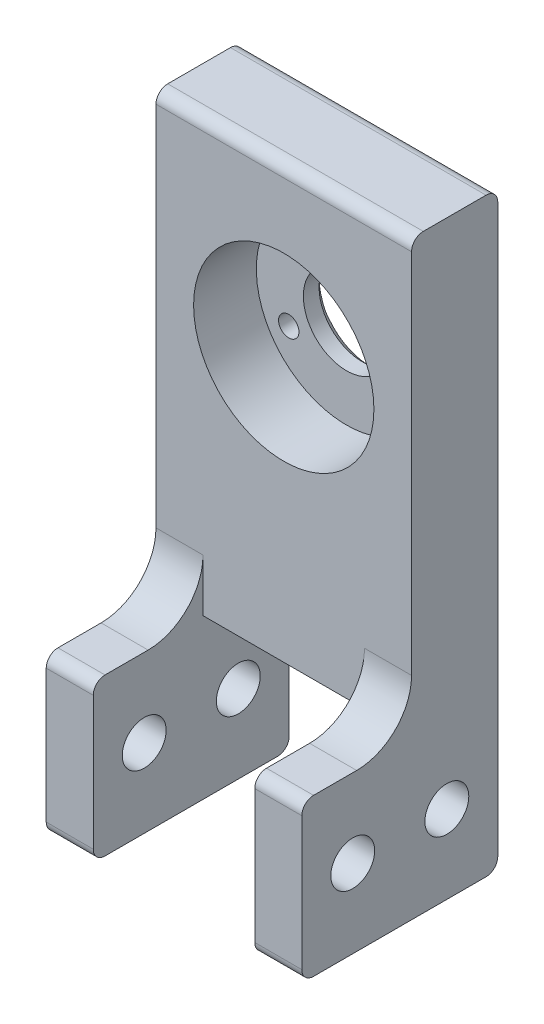
from build123d import *

# Parameters (mm, degrees)
EXTRUDE1_DEPTH      = 10.3
EXTRUDE1_DEPTH_BACK = 10.3
SKETCH1_W           = 11
SKETCH1_H           = 55
EXTRUDE2_DEPTH      = 6
SKETCH5_R           = 5.5
EXTRUDE4_DEPTH      = 69.744308855
SKETCH_1_R          = 2.8
CUT_EXTRUDE_1_DEPTH = 76.545350618
FILLET2_R           = 1.5
SKETCH_3_R          = 11.5
CUT_EXTRUDE_2_DEPTH = 8
SKETCH_4_R          = 1.3
CUT_EXTRUDE_3_DEPTH = 71.80805039
CHAMFER_1_SIZE      = 1


with BuildPart() as part:
    # Sketch1 → Extrude1 (new, two sides: drawn at the far end of the back side and taken through both)
    with BuildSketch(Plane(origin=(0, 0, 0), x_dir=(0, 0, -1), z_dir=(1, 0, 0)).offset(-EXTRUDE1_DEPTH_BACK)):
        with Locations((0, 37.8)):
            Rectangle(SKETCH1_W, SKETCH1_H)
    extrude(amount=EXTRUDE1_DEPTH + EXTRUDE1_DEPTH_BACK)

    # Sketch2 → Extrude2 (add)
    with BuildSketch(Plane(origin=(10.3, 0, 0), x_dir=(0, 0, -1), z_dir=(1, 0, 0))):
        with BuildLine():
            Line((-19.5, 10), (-19.5, -10))
            Line((-19.5, -10), (5.5, -10))
            Line((5.5, -10), (5.5, 17))
            Line((5.5, 17), (5.5, 65.3))
            Line((5.5, 65.3), (-5.5, 65.3))
            Line((-5.5, 65.3), (-5.5, 17))
            ThreePointArc((-5.5, 17), (-7.550252532, 12.050252532), (-12.5, 10))
            Line((-12.5, 10), (-19.5, 10))
        make_face()
    extrude2 = extrude(amount=EXTRUDE2_DEPTH)

    # Mirror2: Extrude2 across plane
    add(extrude2.mirror(Plane(origin=(0, 0, 0), x_dir=(0, 0, 1), z_dir=(1, 0, 0))))

    # Sketch5 → Extrude4 (cut, through all)
    with BuildSketch(Plane.XY.offset(5.5)):
        with Locations((0, 44)):
            Circle(SKETCH5_R)
    extrude(amount=-EXTRUDE4_DEPTH, mode=Mode.SUBTRACT)

    # Эскиз1 → Вырез-Вытянуть1 (cut, through all)
    with BuildSketch(Plane(origin=(16.3, 0, 0), x_dir=(0, 0, -1), z_dir=(1, 0, 0))):
        with Locations((-13, 0)):
            Circle(SKETCH_1_R)
        with Locations(Location((-1, 0, 0), (0, 0, 180))):
            Circle(SKETCH_1_R)
    extrude(amount=-CUT_EXTRUDE_1_DEPTH, mode=Mode.SUBTRACT)

    # Fillet2
    fillet2_edges = [part.edges().sort_by_distance(p)[0] for p in [
        (13.3, -10, 19.5),
        (13.3, -10, -5.5),
        (13.3, 10, 19.5),
        (-13.3, -10, -5.5),
        (-13.3, -10, 19.5),
        (-13.3, 10, 19.5),
        (0, 65.3, 5.5),
        (0, 65.3, -5.5),
    ]]
    fillet(fillet2_edges, radius=FILLET2_R)

    # Эскиз3 → Вырез-Вытянуть2 (cut)
    with BuildSketch(Plane.XY.offset(5.5)):
        with Locations((0, 44)):
            Circle(SKETCH_3_R)
    extrude(amount=-CUT_EXTRUDE_2_DEPTH, mode=Mode.SUBTRACT)

    # Эскиз4 → Вырез-Вытянуть3 (cut, through all)
    with BuildSketch(Plane.XY.offset(-2.5)):
        with Locations((0, 52.5)):
            Circle(SKETCH_4_R)
        with Locations((7.361215932, 39.75)):
            Circle(SKETCH_4_R)
        with Locations((-7.361215932, 39.75)):
            Circle(SKETCH_4_R)
    extrude(amount=-CUT_EXTRUDE_3_DEPTH, mode=Mode.SUBTRACT)

    # Фаска1
    # the kernel refuses this chamfer: 1 mm, written as the material it takes off along each edge
    with BuildSketch(Plane(origin=(0, 52.5, -5.5), x_dir=(1, 0, 0), z_dir=(0, -1, 0))) as chamfer_1_piece_1:
        Polygon((1.3 + CHAMFER_1_SIZE, 0), (1.3, CHAMFER_1_SIZE), (1.3, 0), align=None)
    revolve(axis=Axis((0, 52.5, -5.5), (0, 0, 1)), mode=Mode.SUBTRACT)
    with BuildSketch(Plane(origin=(7.361215932, 39.75, -5.5), x_dir=(1, 0, 0), z_dir=(0, -1, 0))) as chamfer_1_piece_2:
        Polygon((1.3 + CHAMFER_1_SIZE, 0), (1.3, CHAMFER_1_SIZE), (1.3, 0), align=None)
    revolve(axis=Axis((7.361215932, 39.75, -5.5), (0, 0, 1)), mode=Mode.SUBTRACT)
    with BuildSketch(Plane(origin=(-7.361215932, 39.75, -5.5), x_dir=(1, 0, 0), z_dir=(0, -1, 0))) as chamfer_1_piece_3:
        Polygon((1.3 + CHAMFER_1_SIZE, 0), (1.3, CHAMFER_1_SIZE), (1.3, 0), align=None)
    revolve(axis=Axis((-7.361215932, 39.75, -5.5), (0, 0, 1)), mode=Mode.SUBTRACT)
    with BuildSketch(Plane(origin=(0, 44, -5.5), x_dir=(1, 0, 0), z_dir=(0, -1, 0))) as chamfer_1_piece_4:
        Polygon((5.5 + CHAMFER_1_SIZE, 0), (5.5, CHAMFER_1_SIZE), (5.5, 0), align=None)
    revolve(axis=Axis((0, 44, -5.5), (0, 0, 1)), mode=Mode.SUBTRACT)


solid = part.part
